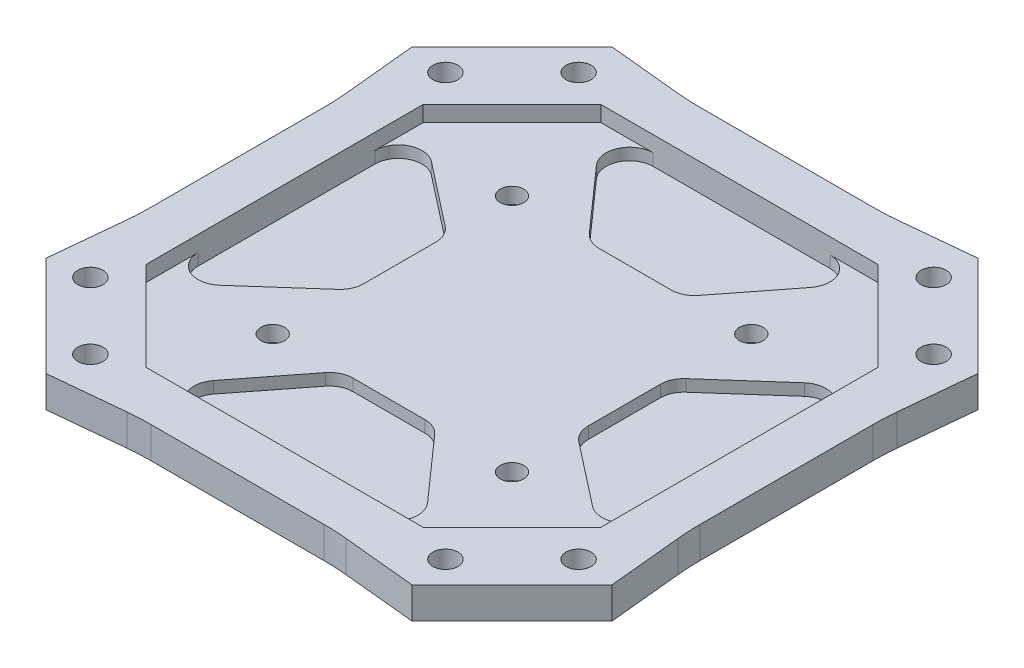
from build123d import *

# Parameters (mm, degrees)
SKETCH1_R           = 1.6
BOSS_EXTRUDE1_DEPTH = 4
CUT_EXTRUDE1_DEPTH  = 2
CUT_EXTRUDE2_DEPTH  = 1.5
SKETCH5_R           = 1.5
CUT_EXTRUDE3_DEPTH  = 52.039025935
FILLET1_R           = 30


with BuildPart() as part:
    # Sketch1 → Boss-Extrude1 (new body)
    with BuildSketch(Plane(origin=(0, 0, 0), x_dir=(1, 0, 0), z_dir=(0, 1, 0))):
        Polygon((-35, 12.5), (-36.062322224, 23.334400163), (-23.334400163, 36.062322224), (-12.5, 35), (12.5, 35), (23.334400163, 36.062322224), (36.062322224, 23.334400163), (35, 12.5), (35, -12.5), (36.062322224, -23.334400163), (23.334400163, -36.062322224), (12.5, -35), (-12.5, -35), (-23.334400163, -36.062322224), (-36.062322224, -23.334400163), (-35, -12.5), align=None)
        with Locations(Location((31.112574756, 22.627293382, 0), (0, 0, 270))):
            Circle(SKETCH1_R, mode=Mode.SUBTRACT)
        with Locations(Location((22.627293382, 31.112574756, 0), (0, 0, 270))):
            Circle(SKETCH1_R, mode=Mode.SUBTRACT)
        with Locations(Location((31.112574756, -22.627293382, 0), (0, 0, 270))):
            Circle(SKETCH1_R, mode=Mode.SUBTRACT)
        with Locations(Location((22.627293382, -31.112574756, 0), (0, 0, 270))):
            Circle(SKETCH1_R, mode=Mode.SUBTRACT)
        with Locations(Location((-22.627293382, -31.112574756, 0), (0, 0, 270))):
            Circle(SKETCH1_R, mode=Mode.SUBTRACT)
        with Locations(Location((-31.112574756, -22.627293382, 0), (0, 0, 270))):
            Circle(SKETCH1_R, mode=Mode.SUBTRACT)
        with Locations(Location((-31.112574756, 22.627293382, 0), (0, 0, 270))):
            Circle(SKETCH1_R, mode=Mode.SUBTRACT)
        with Locations(Location((-22.627293382, 31.112574756, 0), (0, 0, 270))):
            Circle(SKETCH1_R, mode=Mode.SUBTRACT)
    extrude(amount=BOSS_EXTRUDE1_DEPTH)

    # Sketch3 → Cut-Extrude1 (cut)
    with BuildSketch(Plane(origin=(0, 4, 0), x_dir=(1, 0, 0), z_dir=(0, 1, 0))):
        Polygon((-17.668800325, 29), (17.668800325, 29), (29, 17.668800325), (29, -17.668800325), (17.668800325, -29), (-17.668800325, -29), (-29, -17.668800325), (-29, 17.668800325), align=None)
    extrude(amount=-CUT_EXTRUDE1_DEPTH, mode=Mode.SUBTRACT)

    # Sketch4 → Cut-Extrude2 (cut)
    with BuildSketch(Plane(origin=(0, 2, 0), x_dir=(1, 0, 0), z_dir=(0, 1, 0))):
        with BuildLine():
            Line((-29, -11.00200097), (-29, 11.520078787))
            ThreePointArc((-29, 11.520078787), (-27.315491792, 14.216276359), (-24.153679103, 13.884629304))
            Line((-24.153679103, 13.884629304), (-16.153679103, 7.637959136))
            ThreePointArc((-16.153679103, 7.637959136), (-15.303802428, 6.588900412), (-15, 5.273408619))
            Line((-15, 5.273408619), (-15, -3.912899337))
            ThreePointArc((-15, -3.912899337), (-15.264226315, -5.143972993), (-16.010361564, -6.158191945))
            Line((-16.010361564, -6.158191945), (-24.010361564, -13.247293577))
            ThreePointArc((-24.010361564, -13.247293577), (-27.231073656, -13.737774655), (-29, -11.00200097))
        make_face()
        with BuildLine():
            Line((13.884629304, 24.153679103), (7.637959136, 16.153679103))
            ThreePointArc((7.637959136, 16.153679103), (6.588900412, 15.303802428), (5.273408619, 15))
            Line((5.273408619, 15), (-3.912899337, 15))
            ThreePointArc((-3.912899337, 15), (-5.143972993, 15.264226315), (-6.158191945, 16.010361564))
            Line((-6.158191945, 16.010361564), (-13.247293578, 24.010361564))
            ThreePointArc((-13.247293578, 24.010361564), (-13.737774655, 27.231073656), (-11.00200097, 29))
            Line((-11.00200097, 29), (11.520078787, 29))
            ThreePointArc((11.520078787, 29), (14.216276359, 27.315491792), (13.884629304, 24.153679103))
        make_face()
        with BuildLine():
            Line((24.153679103, -13.884629304), (16.153679103, -7.637959136))
            ThreePointArc((16.153679103, -7.637959136), (15.303802428, -6.588900412), (15, -5.273408619))
            Line((15, -5.273408619), (15, 3.912899337))
            ThreePointArc((15, 3.912899337), (15.264226315, 5.143972993), (16.010361564, 6.158191945))
            Line((16.010361564, 6.158191945), (24.010361564, 13.247293578))
            ThreePointArc((24.010361564, 13.247293578), (27.231073656, 13.737774655), (29, 11.00200097))
            Line((29, 11.00200097), (29, -11.520078787))
            ThreePointArc((29, -11.520078787), (27.315491792, -14.216276359), (24.153679103, -13.884629304))
        make_face()
        with BuildLine():
            Line((-13.884629304, -24.153679103), (-7.637959136, -16.153679103))
            ThreePointArc((-7.637959136, -16.153679103), (-6.588900412, -15.303802428), (-5.273408619, -15))
            Line((-5.273408619, -15), (3.912899337, -15))
            ThreePointArc((3.912899337, -15), (5.143972993, -15.264226315), (6.158191945, -16.010361564))
            Line((6.158191945, -16.010361564), (13.247293578, -24.010361564))
            ThreePointArc((13.247293578, -24.010361564), (13.737774655, -27.231073656), (11.00200097, -29))
            Line((11.00200097, -29), (-11.520078787, -29))
            ThreePointArc((-11.520078787, -29), (-14.216276359, -27.315491792), (-13.884629304, -24.153679103))
        make_face()
    extrude(amount=-CUT_EXTRUDE2_DEPTH, mode=Mode.SUBTRACT)

    # Sketch5 → Cut-Extrude3 (cut, through all)
    with BuildSketch(Plane(origin=(0, 2, 0), x_dir=(1, 0, 0), z_dir=(0, 1, 0))):
        with Locations(Location((15.25, 15.25, 0), (0, 0, 270))):
            Circle(SKETCH5_R)
        with Locations(Location((15.25, -15.25, 0), (0, 0, 270))):
            Circle(SKETCH5_R)
        with Locations(Location((-15.25, -15.25, 0), (0, 0, 270))):
            Circle(SKETCH5_R)
        with Locations(Location((-15.25, 15.25, 0), (0, 0, 270))):
            Circle(SKETCH5_R)
    extrude(amount=-CUT_EXTRUDE3_DEPTH, mode=Mode.SUBTRACT)

    # Fillet1
    # the kernel refuses this fillet: 30 mm, written as the material it adds along each edge
    with BuildSketch(Plane(origin=(-35, 0, -12.5), x_dir=(-0.09758289975914561, 0, -0.9952273999818315), z_dir=(0, 1, 0)), Plane(origin=(12.5, 0, 35), x_dir=(-1, 0, 0), z_dir=(0, 1, 0)), Plane(origin=(-12.5, 0, 35), x_dir=(-0.9952273999818316, 0, 0.09758289975914514), z_dir=(0, 1, 0)), Plane(origin=(-35, 0, 12.5), x_dir=(0, 0, -1), z_dir=(0, 1, 0))) as fillet1_piece_1:
        with BuildLine():
            CenterArc((FILLET1_R * 0.0489081594208, FILLET1_R), FILLET1_R, 264.4, 5.6)
            Line((-FILLET1_R * 0.0486747403383, FILLET1_R * 0.00477260001817), (0, 0))
            Line((0, 0), (FILLET1_R * 0.0489081594208, 0))
        make_face()
    extrude(amount=4)
    with BuildSketch(Plane(origin=(-12.5, 0, -35), x_dir=(-0.9952273999818313, 0, -0.09758289975914779), z_dir=(0, 1, 0)), Plane(origin=(12.5, 0, -35), x_dir=(-1, 0, 0), z_dir=(0, 1, 0)), Plane(origin=(35, 0, -12.5), x_dir=(0.0975828997591479, 0, -0.9952273999818313), z_dir=(0, 1, 0)), Plane(origin=(35, 0, 12.5), x_dir=(0, 0, -1), z_dir=(0, 1, 0))) as fillet1_piece_2:
        with BuildLine():
            CenterArc((FILLET1_R * 0.0489081594208, -FILLET1_R), FILLET1_R, 90, 5.6)
            Line((-FILLET1_R * 0.0486747403383, -FILLET1_R * 0.00477260001817), (0, 0))
            Line((0, 0), (FILLET1_R * 0.0489081594208, 0))
        make_face()
    extrude(amount=4)


solid = part.part
